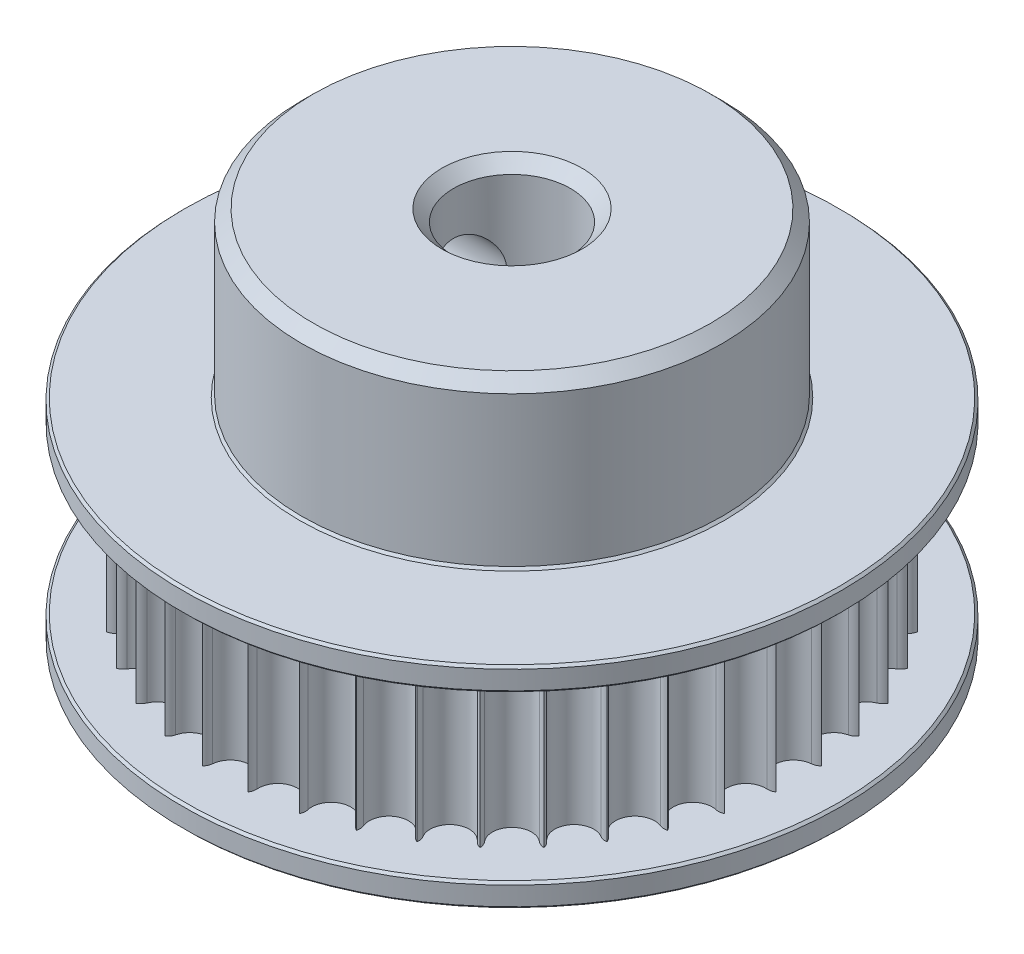
from build123d import *

# Parameters (mm, degrees)
CUT_EXTRUDE3_DEPTH      = 7
CIRPATTERN1_COUNT       = 40
CUT_EXTRUDE2_REACH      = 23.676
CUT_EXTRUDE2_END_RADIUS = 9
SKETCH3_R               = 1.65
CHAMFER1_SIZE           = 1
CHAMFER2_SIZE           = 0.5
CHAMFER3_SIZE           = 0.1


with BuildPart() as part:
    # Skica2 → Revolute (revolve)
    with BuildSketch(Plane.XY):
        Polygon((9, 8.5), (2.5, 8.5), (2.5, -8.5), (6.11, -8.5), (6.11, -7.5), (14.1, -7.5), (14.1, -6.5), (12.5, -6.5), (12.5, 0.5), (14.1, 0.5), (14.1, 1.5), (9, 1.5), align=None)
    revolve(axis=Axis((0, -8.5, 0), (0, 1, 0)))

    # Sketch2 → Cut-Extrude3 (cut)
    with BuildSketch(Plane.XZ.offset(-0.5)):
        with BuildLine():
            ThreePointArc((-0.832572418, 11.97108279), (0, 11.210469025), (0.832572418, 11.97108279))
            ThreePointArc((0.832572418, 11.97108279), (1.014312712, 12.313309772), (1.385975582, 12.422925247))
            ThreePointArc((1.385975582, 12.422925247), (1.771675151, 12.373809727), (2.155660572, 12.312722181))
            ThreePointArc((2.155660572, 12.312722181), (1.541189214, 13.740623371), (0, 13.943632401))
            ThreePointArc((0, 13.943632401), (-1.541189214, 13.740623371), (-2.155660572, 12.312722181))
            ThreePointArc((-2.155660572, 12.312722181), (-1.771675151, 12.373809727), (-1.385975582, 12.422925247))
            ThreePointArc((-1.385975582, 12.422925247), (-1.014312712, 12.313309772), (-0.832572418, 11.97108279))
        make_face()
    cut_extrude3 = extrude(amount=CUT_EXTRUDE3_DEPTH, mode=Mode.SUBTRACT)

    # CirPattern1: Cut-Extrude3 ×40 about axis
    cirpattern1_axis = Axis((0, 0, 0), (0, 1, 0))
    for i in range(1, CIRPATTERN1_COUNT):
        add(cut_extrude3.rotate(cirpattern1_axis, i * 360 / CIRPATTERN1_COUNT), mode=Mode.SUBTRACT)

    # Cut-Extrude2: up to this cylinder (the profile starts inside it)
    cut_extrude2_end = Plane(origin=(0, 4.5, 0), z_dir=(0, -1, 0)) * Cylinder(CUT_EXTRUDE2_END_RADIUS, 66.352, mode=Mode.PRIVATE)
    # Sketch3 → Cut-Extrude2 (cut, up to the surface)
    with BuildSketch(Plane(origin=(0, 0, 0), x_dir=(0, 0, -1), z_dir=(1, 0, 0)), mode=Mode.PRIVATE) as cut_extrude2_sk1:
        with Locations((0, 4.5)):
            Circle(SKETCH3_R)
    cut_extrude2_tool1 = extrude(cut_extrude2_sk1.sketch, amount=-CUT_EXTRUDE2_REACH, mode=Mode.PRIVATE) & cut_extrude2_end
    add(cut_extrude2_tool1.solids().sort_by_distance((0, 4.5, 0))[0], mode=Mode.SUBTRACT)

    # Chamfer1
    chamfer1_edges = [part.edges().sort_by_distance(p)[0] for p in [
        (-6.11, -7.5, 0),
    ]]
    chamfer(chamfer1_edges, length=CHAMFER1_SIZE - 0.0001)  # a hair under: the kernel refuses the full size

    # Chamfer2
    chamfer2_edges = [part.edges().sort_by_distance(p)[0] for p in [
        (-2.5, 8.5, 0),
        (-9, 8.5, 0),
    ]]
    chamfer(chamfer2_edges, length=CHAMFER2_SIZE)

    # Chamfer3
    chamfer3_edges = [part.edges().sort_by_distance(p)[0] for p in [
        (-14.1, 0.5, 0),
        (-14.1, -6.5, 0),
        (-14.1, -7.5, 0),
        (-9, 1.5, 0),
        (-14.1, 1.5, 0),
    ]]
    chamfer(chamfer3_edges, length=CHAMFER3_SIZE)


solid = part.part
